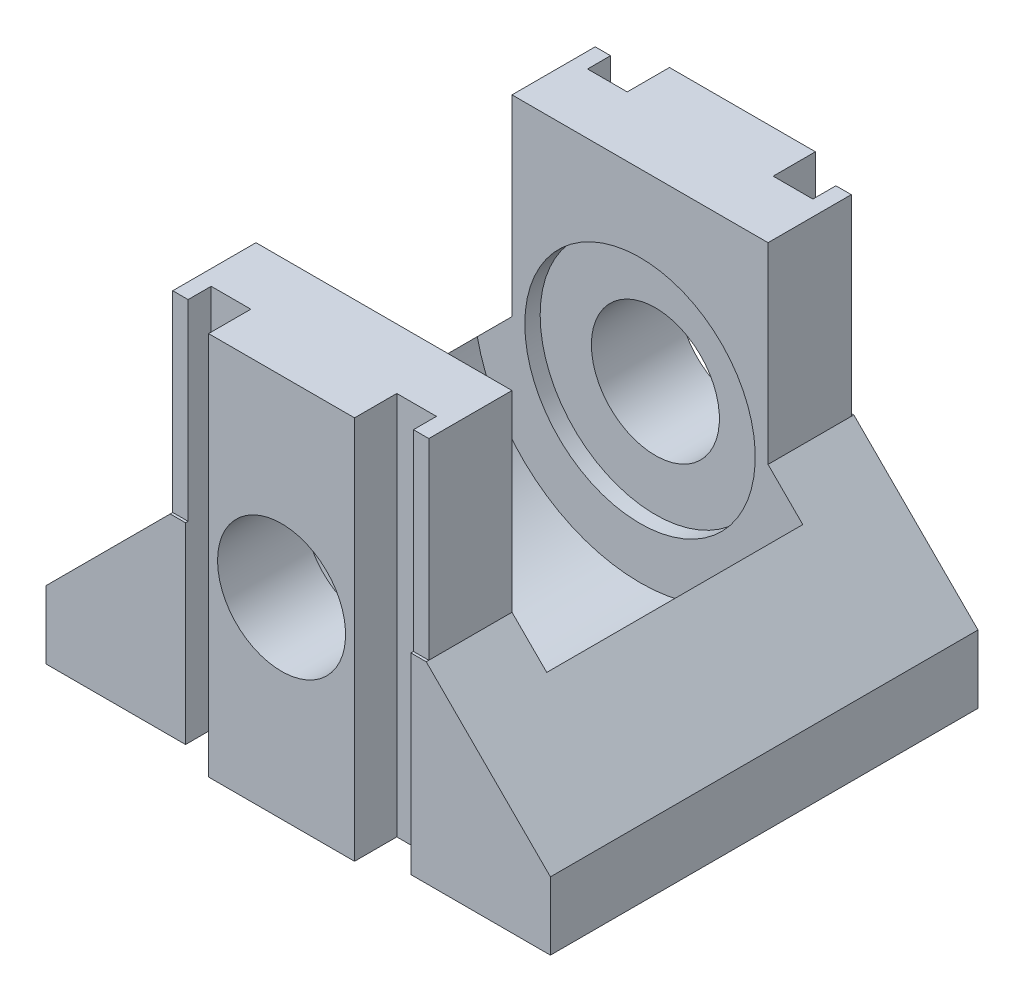
from build123d import *
from build123d.topology import SkipClean

# Parameters (mm, degrees)
SKETCH5_W            = 40
SKETCH5_H            = 15
BOSS_EXTRUDE2_DEPTH  = 17
SKETCH6_R            = 13
CUT_EXTRUDE4_DEPTH   = 10
SKETCH7_R            = 2.5
CUT_EXTRUDE5_DEPTH   = 4.5
CHAMFER8_SIZE        = 10
BOSS_EXTRUDE3_START  = -6.5
BOSS_EXTRUDE3_DEPTH  = 6.5
SKETCH8_R            = 4.8
CUT_EXTRUDE8_DEPTH   = 3
SKETCH9_W            = 2.5
SKETCH9_H            = 2
CUT_EXTRUDE7_DEPTH   = 52
SKETCH11_R           = 5
CUT_EXTRUDE9_DEPTH   = 45
SKETCH12_R           = 9
SKETCH12_R_2         = 5
CUT_EXTRUDE11_DEPTH  = 1.2
CUT_EXTRUDE12_DEPTH  = 53.810983706
BOSS_EXTRUDE4_START  = 1.3
BOSS_EXTRUDE4_DEPTH  = 1.3
BOSS_EXTRUDE8_START  = -33.4
BOSS_EXTRUDE8_DEPTH  = 1.3
BOSS_EXTRUDE9_DEPTH  = 1.5
BOSS_EXTRUDE10_START = -34.5
BOSS_EXTRUDE10_DEPTH = 1.5


# Read off the part's stored shape, not the designer's step: Boss-Extrude3
with BuildPart() as part:
    # Sketch5 → Boss-Extrude2 (new body)
    with BuildSketch(Plane.XY):
        with Locations((-20, 7.5)):
            Rectangle(SKETCH5_W, SKETCH5_H)
    boss_extrude2 = extrude(amount=BOSS_EXTRUDE2_DEPTH)

    # Sketch6 → Cut-Extrude4 (cut)
    with BuildSketch(Plane(origin=(0, 0, 0), x_dir=(-1, 0, 0), z_dir=(0, 0, -1))):
        with Locations((20, 15)):
            Circle(SKETCH6_R)
    cut_extrude4 = extrude(amount=-CUT_EXTRUDE4_DEPTH, mode=Mode.SUBTRACT)

    # Sketch7 → Cut-Extrude5 (cut)
    with BuildSketch(Plane.XY.offset(17)):
        with Locations((-20, 15)):
            Circle(SKETCH7_R)
    cut_extrude5 = extrude(amount=-CUT_EXTRUDE5_DEPTH, mode=Mode.SUBTRACT)

    # Mirror5: Boss-Extrude2, Cut-Extrude4, Cut-Extrude5 across plane
    with SkipClean():  # the faces are left unmerged after this step: merging them gives an invalid solid
        add(boss_extrude2.mirror(Plane.XY))
        add(cut_extrude4.mirror(Plane.XY), mode=Mode.SUBTRACT)
        add(cut_extrude5.mirror(Plane.XY), mode=Mode.SUBTRACT)
    add(part.part.scale(1), mode=Mode.REPLACE)  # the faces are merged on a copy

    # Chamfer8
    # the kernel refuses this chamfer: 10 mm, written as the material it takes off along each edge
    with BuildSketch(Plane(origin=(-40, 15, -42.71682988), x_dir=(0.9996219169112968, 0.027495876610586317, 0), z_dir=(0, 0, 1)), Plane(origin=(0, 15, 42.71682988), x_dir=(-0.9996219169112968, 0.027495876610586317, 0), z_dir=(0, 0, -1))) as chamfer8_piece_1:
        Polygon((CHAMFER8_SIZE * 0.999621916911, -CHAMFER8_SIZE * 0.0274958766106), (-CHAMFER8_SIZE * 0.0274958766106, -CHAMFER8_SIZE * 0.999621916911), (0, 0), align=None)
    extrude(amount=85.433659759, mode=Mode.SUBTRACT)

    # Boss-Extrude3 outline → Boss-Extrude3 (add)
    with BuildSketch(Plane.XY.offset(-10).offset(BOSS_EXTRUDE3_START)):
        with BuildLine():
            Line((-10, 30), (-30, 30))
            Line((-30, 30), (-30, 15))
            Line((-30, 15), (-22.5, 15))
            ThreePointArc((-22.5, 15), (-20, 12.5), (-17.5, 15))
            Line((-17.5, 15), (-10, 15))
            Line((-10, 15), (-10, 30))
        make_face()
    boss_extrude3 = extrude(amount=BOSS_EXTRUDE3_DEPTH)

    # Mirror6: Boss-Extrude3 across plane
    add(boss_extrude3.mirror(Plane(origin=(0, 0, 0), x_dir=(1, 0, 0), z_dir=(0, 0, -1))))

    # Sketch8 → Cut-Extrude8 (cut)
    with BuildSketch(Plane.XZ):
        with Locations(Location((-33, 11.5, 0), (0, 0, 270))):
            Circle(SKETCH8_R)
        with Locations(Location((-7, 11.5, 0), (0, 0, 90))):
            Circle(SKETCH8_R)
        with Locations(Location((-7, -11.5, 0), (0, 0, 270))):
            Circle(SKETCH8_R)
        with Locations(Location((-33, -11.5, 0), (0, 0, 90))):
            Circle(SKETCH8_R)
    extrude(amount=-CUT_EXTRUDE8_DEPTH, mode=Mode.SUBTRACT)

    # Sketch9 → Cut-Extrude7 (cut)
    with BuildSketch(Plane.XZ):
        with Locations((-12.75, 16)):
            Rectangle(SKETCH9_W, SKETCH9_H)
        with Locations((-27.25, 16)):
            Rectangle(SKETCH9_W, SKETCH9_H)
        with Locations((-12.75, -16)):
            Rectangle(SKETCH9_W, SKETCH9_H)
        with Locations((-27.25, -16)):
            Rectangle(SKETCH9_W, SKETCH9_H)
    extrude(amount=-CUT_EXTRUDE7_DEPTH, mode=Mode.SUBTRACT)

    # Sketch11 → Cut-Extrude9 (cut, symmetric)
    with BuildSketch(Plane(origin=(0, 0, 10), x_dir=(-1, 0, 0), z_dir=(0, 0, -1))):
        with Locations((20, 15)):
            Circle(SKETCH11_R)
    extrude(amount=CUT_EXTRUDE9_DEPTH, both=True, mode=Mode.SUBTRACT)

    # Sketch12 → Cut-Extrude11 (cut)
    with BuildSketch(Plane(origin=(0, 0, 10), x_dir=(-1, 0, 0), z_dir=(0, 0, -1))):
        with Locations((20, 15)):
            Circle(SKETCH12_R)
        with Locations((20, 15)):
            Circle(SKETCH12_R_2, mode=Mode.SUBTRACT)
    cut_extrude11 = extrude(amount=-CUT_EXTRUDE11_DEPTH, mode=Mode.SUBTRACT)

    # Mirror7: Cut-Extrude11 across plane
    add(cut_extrude11.mirror(Plane(origin=(0, 0, 0), x_dir=(1, 0, 0), z_dir=(0, 0, -1))), mode=Mode.SUBTRACT)

    # Sketch13 → Cut-Extrude12 (cut, through all)
    with BuildSketch(Plane.XZ):
        Polygon((-26, 15), (-28.5, 15), (-28.5, 17), (-40, 17), (-40, -17), (-28.5, -17), (-28.5, -15), (-26, -15), (-26, -17), (-14, -17), (-14, -15), (-11.5, -15), (-11.5, -17), (0, -17), (0, 17), (-11.5, 17), (-11.5, 15), (-14, 15), (-14, 17), (-26, 17), align=None)
        Polygon((-25.7, 14.7), (-28.8, 14.7), (-28.8, 16.7), (-39.7, 16.7), (-39.7, -16.7), (-28.8, -16.7), (-28.8, -14.7), (-25.7, -14.7), (-25.7, -16.7), (-14.3, -16.7), (-14.3, -14.7), (-11.2, -14.7), (-11.2, -16.7), (-0.3, -16.7), (-0.3, 16.7), (-11.2, 16.7), (-11.2, 14.7), (-14.3, 14.7), (-14.3, 16.7), (-25.7, 16.7), align=None, mode=Mode.SUBTRACT)
    extrude(amount=-CUT_EXTRUDE12_DEPTH, mode=Mode.SUBTRACT)

    # Sketch14 → Boss-Extrude4 (add)
    with SkipClean():  # the faces are left unmerged after this step: merging them gives an invalid solid
        with BuildSketch(Plane(origin=(0, 0, -16.7), x_dir=(-1, 0, 0), z_dir=(0, 0, -1)).offset(BOSS_EXTRUDE4_START)):
            with BuildLine():
                Line((15, 15), (14.3, 15))
                Line((14.3, 15), (14.3, 0))
                Line((14.3, 0), (25.7, 0))
                Line((25.7, 0), (25.7, 15))
                Line((25.7, 15), (25, 15))
                ThreePointArc((25, 15), (20, 10), (15, 15))
            make_face()
        extrude(amount=-BOSS_EXTRUDE4_DEPTH)
    add(part.part.scale(1), mode=Mode.REPLACE)  # the faces are merged on a copy

    # Sketch14<3> → Boss-Extrude8 (add)
    with BuildSketch(Plane(origin=(0, 0, -16.7), x_dir=(-1, 0, 0), z_dir=(0, 0, -1)).offset(BOSS_EXTRUDE8_START)):
        with BuildLine():
            Line((15, 15), (14.3, 15))
            Line((14.3, 15), (14.3, 0))
            Line((14.3, 0), (25.7, 0))
            Line((25.7, 0), (25.7, 15))
            Line((25.7, 15), (25, 15))
            ThreePointArc((25, 15), (20, 10), (15, 15))
        make_face()
    extrude(amount=-BOSS_EXTRUDE8_DEPTH)

    # Sketch16 → Boss-Extrude9 (add)
    with BuildSketch(Plane.XY.offset(16.5)):
        with BuildLine():
            Line((-25.7, 30), (-25.7, 15))
            Line((-25.7, 15), (-25, 15))
            ThreePointArc((-25, 15), (-20, 20), (-15, 15))
            Line((-15, 15), (-14.3, 15))
            Line((-14.3, 15), (-14.3, 30))
            Line((-14.3, 30), (-25.7, 30))
        make_face()
    extrude(amount=BOSS_EXTRUDE9_DEPTH)

    # Sketch16<2> → Boss-Extrude10 (add)
    with SkipClean():  # the faces are left unmerged after this step: merging them gives an invalid solid
        with BuildSketch(Plane.XY.offset(16.5).offset(BOSS_EXTRUDE10_START)):
            with BuildLine():
                Line((-25.7, 30), (-25.7, 15))
                Line((-25.7, 15), (-25, 15))
                ThreePointArc((-25, 15), (-20, 20), (-15, 15))
                Line((-15, 15), (-14.3, 15))
                Line((-14.3, 15), (-14.3, 30))
                Line((-14.3, 30), (-25.7, 30))
            make_face()
        extrude(amount=BOSS_EXTRUDE10_DEPTH)
    add(part.part.scale(1), mode=Mode.REPLACE)  # the faces are merged on a copy


solid = part.part
